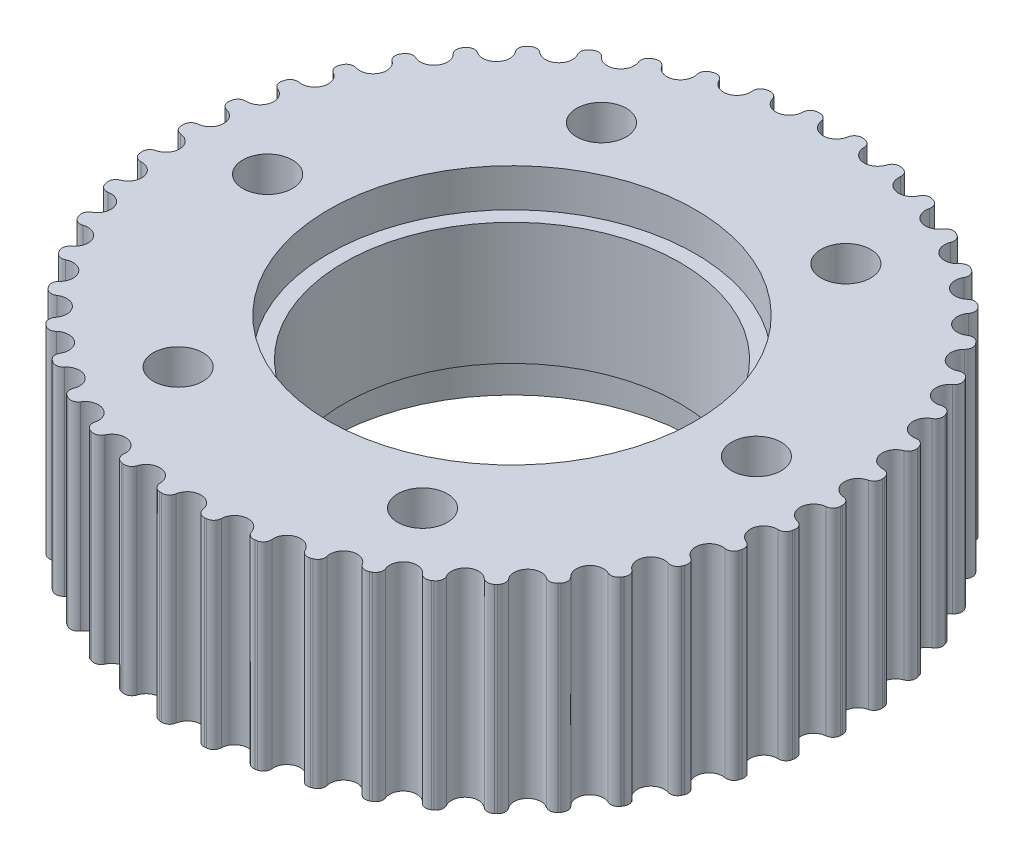
from build123d import *

# Parameters (mm, degrees)
BOSS_EXTRUDE1_DEPTH     = 6.499999954
CIRPATTERN1_COUNT       = 46
CUT_EXTRUDE1_DEPTH      = 32.175108964
CUT_EXTRUDE1_DEPTH_BACK = 32.175108964
SKETCH3_R               = 10.999999971
SKETCH4_R               = 1.625
CUT_EXTRUDE2_DEPTH      = 32.175108964
CIRPATTERN2_COUNT       = 6
CUT_EXTRUDE3_START      = 4.000000128
SKETCH7_R               = 12.000000003
CUT_EXTRUDE3_DEPTH      = 28.175108836


with BuildPart() as part:
    # Sketch1 → Boss-Extrude1 (new, symmetric)
    with BuildSketch(Plane(origin=(0, 0, 0), x_dir=(1, 0, 0), z_dir=(0, 1, 0))):
        with BuildLine():
            ThreePointArc((0.879311396, 21.114512434), (0.578665758, 20.57583177), (0, 20.3620314))
            ThreePointArc((0, 20.3620314), (-1.389554164, -20.314562805), (2.772629585, 20.172378341))
            ThreePointArc((2.772629585, 20.172378341), (2.228466031, 20.46298234), (2.003970963, 21.037583612))
            ThreePointArc((2.003970963, 21.037583612), (1.866829754, 21.372398068), (1.539728474, 21.527036951))
            ThreePointArc((1.539728474, 21.527036951), (1.472809915, 21.531718803), (1.405877127, 21.536192634))
            ThreePointArc((1.405877127, 21.536192634), (1.060765828, 21.427534351), (0.879311396, 21.114512434))
        make_face()
    boss_extrude1 = extrude(amount=BOSS_EXTRUDE1_DEPTH, both=True)

    # CirPattern1: Boss-Extrude1 ×46 about axis
    cirpattern1_axis = Axis((0, 3.3, 0), (0, -1, 0))
    for i in range(1, CIRPATTERN1_COUNT):
        add(boss_extrude1.rotate(cirpattern1_axis, i * 360 / CIRPATTERN1_COUNT))

    # Sketch3 → Cut-Extrude1 (cut, two sides: drawn at the far end of the back side and taken through both)
    with BuildSketch(Plane(origin=(0, 0, 0), x_dir=(-1, 0, 0), z_dir=(0, -1, 0)).offset(-CUT_EXTRUDE1_DEPTH_BACK)):
        Circle(SKETCH3_R)
    extrude(amount=CUT_EXTRUDE1_DEPTH + CUT_EXTRUDE1_DEPTH_BACK, mode=Mode.SUBTRACT)

    # Sketch4 → Cut-Extrude2 (cut, symmetric)
    with BuildSketch(Plane(origin=(0, 0, 0), x_dir=(1, 0, 0), z_dir=(0, 1, 0))):
        with Locations((-16.000000004, 0)):
            Circle(SKETCH4_R)
    cut_extrude2 = extrude(amount=CUT_EXTRUDE2_DEPTH, both=True, mode=Mode.SUBTRACT)

    # CirPattern2: Cut-Extrude2 ×6 about axis
    cirpattern2_axis = Axis((0, 6.499999954, 0), (0, -1, 0))
    for i in range(1, CIRPATTERN2_COUNT):
        add(cut_extrude2.rotate(cirpattern2_axis, i * 360 / CIRPATTERN2_COUNT), mode=Mode.SUBTRACT)

    # Sketch7 → Cut-Extrude3 (cut, through all)
    with BuildSketch(Plane(origin=(0, 0, 0), x_dir=(1, 0, 0), z_dir=(0, 1, 0)).offset(CUT_EXTRUDE3_START)):
        Circle(SKETCH7_R)
    cut_extrude3 = extrude(amount=CUT_EXTRUDE3_DEPTH, mode=Mode.SUBTRACT)

    # Mirror2: Cut-Extrude3 across plane
    add(cut_extrude3.mirror(Plane.ZX), mode=Mode.SUBTRACT)


solid = part.part
